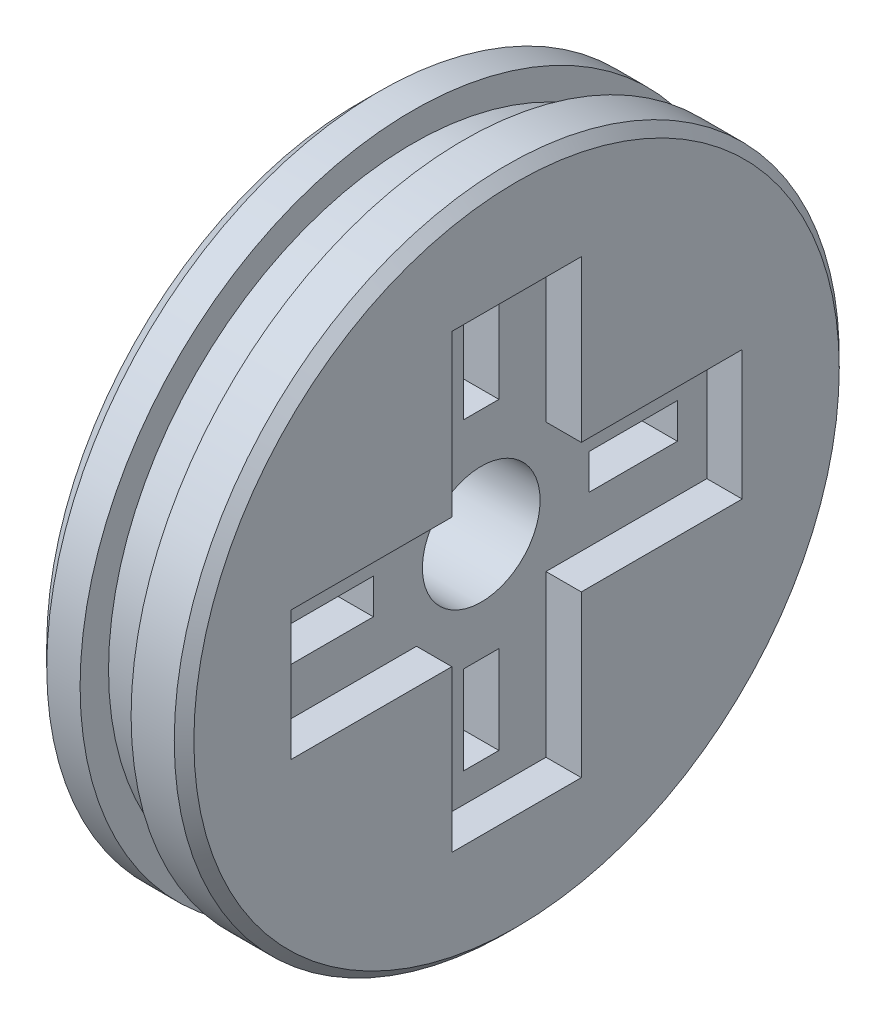
from build123d import *

# Parameters (mm, degrees)
SKETCH2_W            = 2.6
SKETCH2_H            = 2.45
BOSS_EXTRUDE1_START  = -55.3
SKETCH3_W            = 2.3
SKETCH3_H            = 23
BOSS_EXTRUDE1_DEPTH  = 6.6
BOSS_EXTRUDE2_START  = -63.5
SKETCH4_W            = 2.3
SKETCH4_H            = 6.6
BOSS_EXTRUDE2_DEPTH  = 23
BOSS_EXTRUDE3_START  = -79
SKETCH5_R            = 4.6
BOSS_EXTRUDE3_DEPTH  = 2.3
BOSS_EXTRUDE4_START  = -85.7
SKETCH6_R            = 7.1
BOSS_EXTRUDE4_DEPTH  = 1.7
BOSS_EXTRUDE5_START  = -84.1
SKETCH7_R            = 3
BOSS_EXTRUDE5_DEPTH  = 5.2
BOSS_EXTRUDE6_START  = -52.9
SKETCH8_W            = 4.1
SKETCH8_H            = 2.1
BOSS_EXTRUDE6_DEPTH  = 1.8
BOSS_EXTRUDE7_START  = -46.5
SKETCH9_W            = 4.1
SKETCH9_H            = 1.8
BOSS_EXTRUDE7_DEPTH  = 2.1
BOSS_EXTRUDE8_START  = -52.9
SKETCH10_W           = 4.1
SKETCH10_H           = 2.1
BOSS_EXTRUDE8_DEPTH  = 1.8
BOSS_EXTRUDE9_START  = -59.6
SKETCH11_W           = 4.1
SKETCH11_H           = 1.8
BOSS_EXTRUDE9_DEPTH  = 2.1
BOSS_EXTRUDE10_START = -52.9
SKETCH12_W           = 5.3
SKETCH12_H           = 2.4
BOSS_EXTRUDE10_DEPTH = 1.8
BOSS_EXTRUDE11_START = -44.4
SKETCH13_W           = 5.3
SKETCH13_H           = 1.8
BOSS_EXTRUDE11_DEPTH = 2.4
BOSS_EXTRUDE12_START = -52.9
SKETCH14_W           = 5.3
SKETCH14_H           = 2.4
BOSS_EXTRUDE12_DEPTH = 1.8
BOSS_EXTRUDE13_START = -62
SKETCH15_W           = 5.3
SKETCH15_H           = 1.8
BOSS_EXTRUDE13_DEPTH = 2.4


with BuildPart() as part:
    # Sketch1 → Revolve1 (revolve)
    with BuildSketch(Plane.XY.offset(-52)):
        Polygon((-77.2, -65), (-85.2, -65), (-85.2, -49.05), (-84.2, -48.05), (-77.7, -48.05), (-77.2, -48.55), align=None)
    revolve(axis=Axis((-90.2, -65, -52), (1, 0, 0)))


with BuildPart() as body_2:
    # Sketch2 → Revolve2 (revolve)
    with BuildSketch(Plane.XY.offset(-52)):
        with Locations((-81.2, -48.275)):
            Rectangle(SKETCH2_W, SKETCH2_H)
    revolve(axis=Axis((-87.5, -65, -52), (1, 0, 0)))


with BuildPart() as part_1:
    add(part.part)

    # Combine1: cut body 2
    add(body_2.part, mode=Mode.SUBTRACT)


with BuildPart() as body_2_2:
    # Sketch3 → Boss-Extrude1 (new body)
    with BuildSketch(Plane.XY.offset(BOSS_EXTRUDE1_START)):
        with Locations((-77.85, -65)):
            Rectangle(SKETCH3_W, SKETCH3_H)
    extrude(amount=BOSS_EXTRUDE1_DEPTH)


with BuildPart() as part_2:
    add(part_1.part)

    # Combine2: cut body 2 2
    add(body_2_2.part, mode=Mode.SUBTRACT)


with BuildPart() as body_2_3:
    # Sketch4 → Boss-Extrude2 (new body)
    with BuildSketch(Plane.XY.offset(BOSS_EXTRUDE2_START)):
        with Locations((-77.85, -65)):
            Rectangle(SKETCH4_W, SKETCH4_H)
    extrude(amount=BOSS_EXTRUDE2_DEPTH)


with BuildPart() as part_3:
    add(part_2.part)

    # Combine3: cut body 2 3
    add(body_2_3.part, mode=Mode.SUBTRACT)


with BuildPart() as body_2_4:
    # Sketch5 → Boss-Extrude3 (new body)
    with BuildSketch(Plane(origin=(0, 0, 0), x_dir=(0, 0, -1), z_dir=(1, 0, 0)).offset(BOSS_EXTRUDE3_START)):
        with Locations((52, -65)):
            Circle(SKETCH5_R)
    extrude(amount=BOSS_EXTRUDE3_DEPTH)


with BuildPart() as part_4:
    add(part_3.part)

    # Combine4: cut body 2 4
    add(body_2_4.part, mode=Mode.SUBTRACT)


with BuildPart() as body_2_5:
    # Sketch6 → Boss-Extrude4 (new body)
    with BuildSketch(Plane(origin=(0, 0, 0), x_dir=(0, 0, -1), z_dir=(1, 0, 0)).offset(BOSS_EXTRUDE4_START)):
        with Locations((52, -65)):
            Circle(SKETCH6_R)
    extrude(amount=BOSS_EXTRUDE4_DEPTH)


with BuildPart() as part_5:
    add(part_4.part)

    # Combine5: cut body 2 5
    add(body_2_5.part, mode=Mode.SUBTRACT)


with BuildPart() as body_2_6:
    # Sketch7 → Boss-Extrude5 (new body)
    with BuildSketch(Plane(origin=(0, 0, 0), x_dir=(0, 0, -1), z_dir=(1, 0, 0)).offset(BOSS_EXTRUDE5_START)):
        with Locations((52, -65)):
            Circle(SKETCH7_R)
    extrude(amount=BOSS_EXTRUDE5_DEPTH)


with BuildPart() as part_6:
    add(part_5.part)

    # Combine6: cut body 2 6
    add(body_2_6.part, mode=Mode.SUBTRACT)


with BuildPart() as body_2_7:
    # Sketch8 → Boss-Extrude6 (new body)
    with BuildSketch(Plane.XY.offset(BOSS_EXTRUDE6_START)):
        with Locations((-80.95, -58.45)):
            Rectangle(SKETCH8_W, SKETCH8_H)
    extrude(amount=BOSS_EXTRUDE6_DEPTH)


with BuildPart() as part_7:
    add(part_6.part)

    # Combine7: cut body 2 7
    add(body_2_7.part, mode=Mode.SUBTRACT)


with BuildPart() as body_2_8:
    # Sketch9 → Boss-Extrude7 (new body)
    with BuildSketch(Plane.XY.offset(BOSS_EXTRUDE7_START)):
        with Locations((-80.95, -65)):
            Rectangle(SKETCH9_W, SKETCH9_H)
    extrude(amount=BOSS_EXTRUDE7_DEPTH)


with BuildPart() as part_8:
    add(part_7.part)

    # Combine8: cut body 2 8
    add(body_2_8.part, mode=Mode.SUBTRACT)


with BuildPart() as body_2_9:
    # Sketch10 → Boss-Extrude8 (new body)
    with BuildSketch(Plane.XY.offset(BOSS_EXTRUDE8_START)):
        with Locations((-80.95, -71.55)):
            Rectangle(SKETCH10_W, SKETCH10_H)
    extrude(amount=BOSS_EXTRUDE8_DEPTH)


with BuildPart() as part_9:
    add(part_8.part)

    # Combine9: cut body 2 9
    add(body_2_9.part, mode=Mode.SUBTRACT)


with BuildPart() as body_2_10:
    # Sketch11 → Boss-Extrude9 (new body)
    with BuildSketch(Plane.XY.offset(BOSS_EXTRUDE9_START)):
        with Locations((-80.95, -65)):
            Rectangle(SKETCH11_W, SKETCH11_H)
    extrude(amount=BOSS_EXTRUDE9_DEPTH)


with BuildPart() as part_10:
    add(part_9.part)

    # Combine10: cut body 2 10
    add(body_2_10.part, mode=Mode.SUBTRACT)


with BuildPart() as body_2_11:
    # Sketch12 → Boss-Extrude10 (new body)
    with BuildSketch(Plane.XY.offset(BOSS_EXTRUDE10_START)):
        with Locations((-81.55, -56.2)):
            Rectangle(SKETCH12_W, SKETCH12_H)
    extrude(amount=BOSS_EXTRUDE10_DEPTH)


with BuildPart() as part_11:
    add(part_10.part)

    # Combine11: cut body 2 11
    add(body_2_11.part, mode=Mode.SUBTRACT)


with BuildPart() as body_2_12:
    # Sketch13 → Boss-Extrude11 (new body)
    with BuildSketch(Plane.XY.offset(BOSS_EXTRUDE11_START)):
        with Locations((-81.55, -65)):
            Rectangle(SKETCH13_W, SKETCH13_H)
    extrude(amount=BOSS_EXTRUDE11_DEPTH)


with BuildPart() as part_12:
    add(part_11.part)

    # Combine12: cut body 2 12
    add(body_2_12.part, mode=Mode.SUBTRACT)


with BuildPart() as body_2_13:
    # Sketch14 → Boss-Extrude12 (new body)
    with BuildSketch(Plane.XY.offset(BOSS_EXTRUDE12_START)):
        with Locations((-81.55, -73.8)):
            Rectangle(SKETCH14_W, SKETCH14_H)
    extrude(amount=BOSS_EXTRUDE12_DEPTH)


with BuildPart() as part_13:
    add(part_12.part)

    # Combine13: cut body 2 13
    add(body_2_13.part, mode=Mode.SUBTRACT)


with BuildPart() as body_2_14:
    # Sketch15 → Boss-Extrude13 (new body)
    with BuildSketch(Plane.XY.offset(BOSS_EXTRUDE13_START)):
        with Locations((-81.55, -65)):
            Rectangle(SKETCH15_W, SKETCH15_H)
    extrude(amount=BOSS_EXTRUDE13_DEPTH)


with BuildPart() as part_14:
    add(part_13.part)

    # Combine14: cut body 2 14
    add(body_2_14.part, mode=Mode.SUBTRACT)


solid = part_14.part
